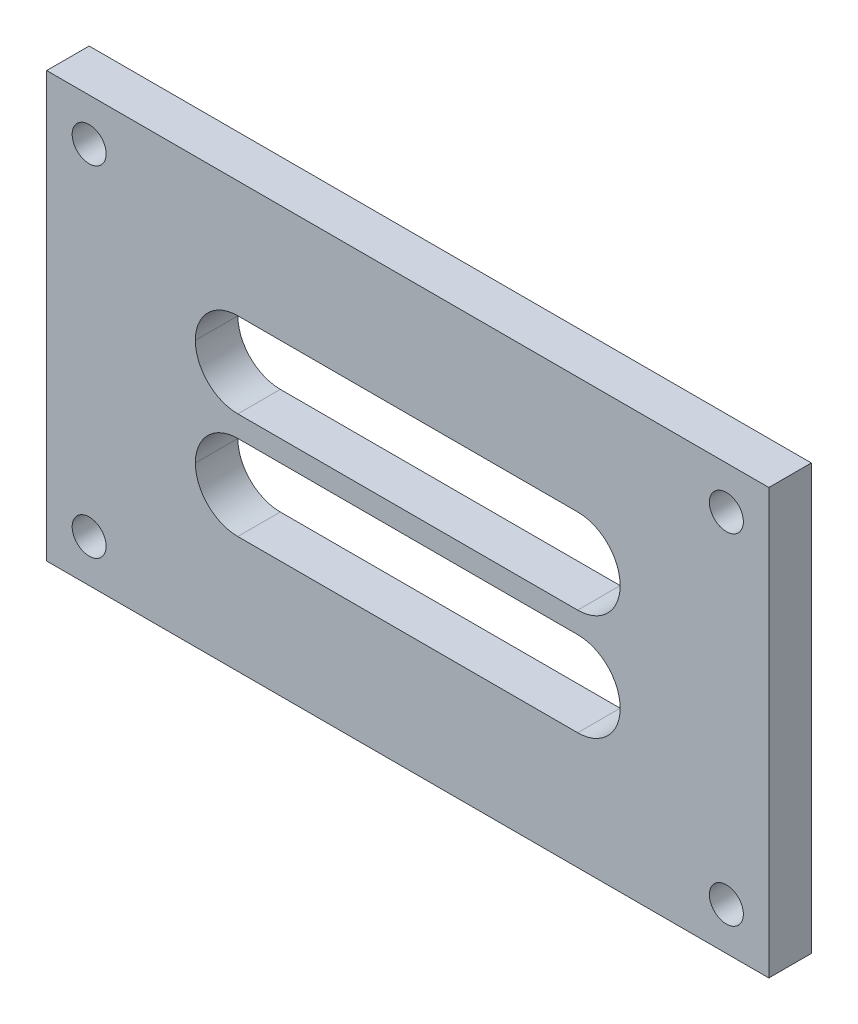
from build123d import *

# Parameters (mm, degrees)
BOSS_EXTRUDE2_DEPTH = 2
SKETCH2_R           = 0.8
CUT_EXTRUDE1_DEPTH  = 2
FILLET1_R           = 2


with BuildPart() as part:
    # Sketch1 → Boss-Extrude2 (new body)
    with BuildSketch(Plane.XY):
        Polygon((17, 10.5), (17, 10), (34, 10), (34, 20), (17, 20), (17, 14.5), (27, 14.5), (27, 10.5), align=None)
        Polygon((34, 10), (17, 10), (17, 9.5), (27, 9.5), (27, 5.5), (17, 5.5), (17, 0), (34, 0), align=None)
        Polygon((17, 10), (0, 10), (0, 0), (17, 0), (17, 5.5), (7, 5.5), (7, 9.5), (17, 9.5), align=None)
        Polygon((0, 20), (0, 10), (17, 10), (17, 10.5), (7, 10.5), (7, 14.5), (17, 14.5), (17, 20), align=None)
    extrude(amount=BOSS_EXTRUDE2_DEPTH)

    # Sketch2 → Cut-Extrude1 (cut)
    with BuildSketch(Plane.XY.offset(2)):
        with Locations((2, 2)):
            Circle(SKETCH2_R)
        with Locations((2, 18)):
            Circle(SKETCH2_R)
        with Locations((32, 18)):
            Circle(SKETCH2_R)
        with Locations((32, 2)):
            Circle(SKETCH2_R)
    extrude(amount=-CUT_EXTRUDE1_DEPTH, mode=Mode.SUBTRACT)

    # Fillet1
    fillet1_edges = [part.edges().sort_by_distance(p)[0] for p in [
        (7, 9.5, 1),
        (7, 5.5, 1),
        (27, 9.5, 1),
        (27, 5.5, 1),
        (27, 10.5, 1),
        (27, 14.5, 1),
        (7, 10.5, 1),
        (7, 14.5, 1),
    ]]
    fillet(fillet1_edges, radius=FILLET1_R - 0.0001)  # a hair under: the kernel refuses the full size


solid = part.part
